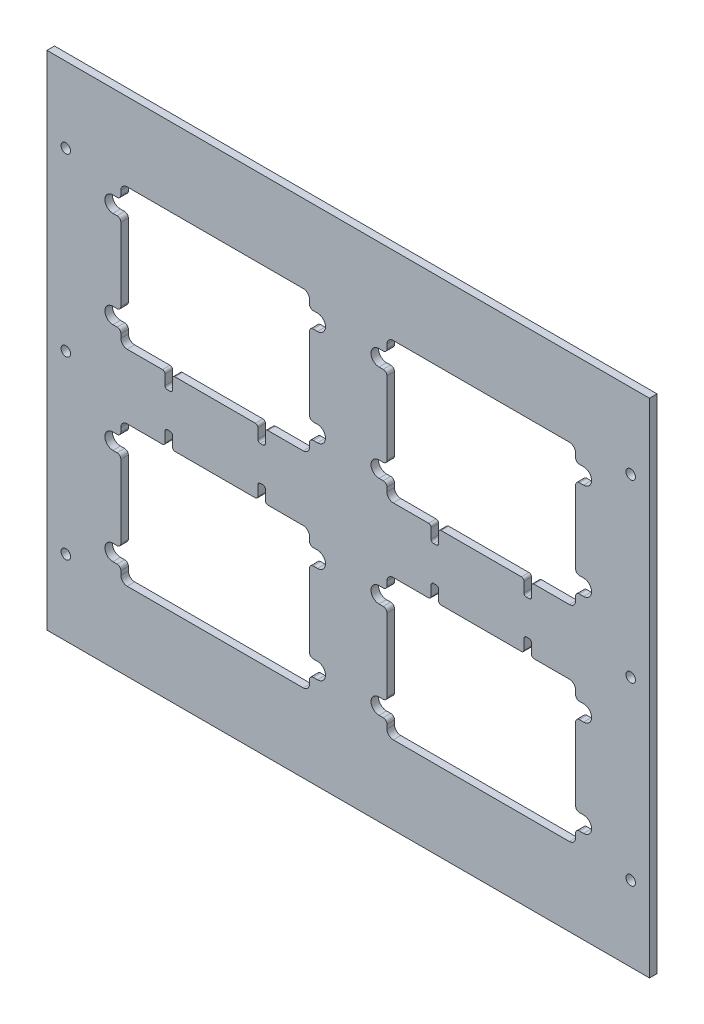
from build123d import *

# Parameters (mm, degrees)
SKETCH2_W                     = 200
SKETCH2_H                     = 240
BOSS_EXTRUDE1_DEPTH           = 3
F_6_CLEARANCE_HOLE1_D         = 3.7973
F_6_CLEARANCE_HOLE1_DEPTH     = 19.9898
F_6_CLEARANCE_HOLE1_TIP       = 1.140824014
BODY_MOVE_COPY1_ANGLE         = 90
TAP_DRILL_FOR_6_32_TAP1_D     = 2.7051
TAP_DRILL_FOR_6_32_TAP1_DEPTH = 20
TAP_DRILL_FOR_6_32_TAP1_TIP   = 0.81269403
CUT_EXTRUDE1_DEPTH            = 395.473066254


with BuildPart() as part:
    # Sketch2 → Boss-Extrude1 (new body)
    with BuildSketch(Plane.XY):
        Rectangle(SKETCH2_W, SKETCH2_H)
    extrude(amount=BOSS_EXTRUDE1_DEPTH)

    # #6 Clearance Hole1
    with Locations(Plane.XY.offset(3)):
        with Locations((-70, 112.5), (0, 112.5), (70, 112.5), (70, -112.5), (0, -112.5), (-70, -112.5)):
            Hole(F_6_CLEARANCE_HOLE1_D / 2, depth=F_6_CLEARANCE_HOLE1_DEPTH)
            with Locations((0, 0, -(F_6_CLEARANCE_HOLE1_DEPTH + F_6_CLEARANCE_HOLE1_TIP / 2))):  # 118° drill point
                Cone(0, F_6_CLEARANCE_HOLE1_D / 2, F_6_CLEARANCE_HOLE1_TIP, mode=Mode.SUBTRACT)


with BuildPart() as part_1:
    # Body-Move/Copy1: read off the stored shape, not the designer's step
    # Body-Move/Copy1: moved
    add(part.part.moved(Location((-100, 220, 0))).rotate(Axis((0, 0, 0), (0, 0, -1)), BODY_MOVE_COPY1_ANGLE))

    # Tap Drill for #6-32 Tap1
    with Locations(Plane(origin=(220, 100, 3), x_dir=(0.0027465713652910567, 0.9999962281657544, 0), z_dir=(0, 0, 1))):
        with Locations((-60.332264473, 93.584646116), (-21.932409311, 93.690114456), (21.41742718, 93.809178325), (59.817282342, 93.914646665), (60.041127908, 12.41495407), (21.641272746, 12.309485729), (-21.708563745, 12.190421861), (-60.108418906, 12.08495352), (-60.041127908, -12.41495407), (-21.641272746, -12.309485729), (21.708563745, -12.190421861), (60.108418906, -12.08495352), (60.332264473, -93.584646116), (21.932409311, -93.690114456), (-21.41742718, -93.809178325), (-59.817282342, -93.914646665)):
            Hole(TAP_DRILL_FOR_6_32_TAP1_D / 2, depth=TAP_DRILL_FOR_6_32_TAP1_DEPTH)
            with Locations((0, 0, -(TAP_DRILL_FOR_6_32_TAP1_DEPTH + TAP_DRILL_FOR_6_32_TAP1_TIP / 2))):  # 118° drill point
                Cone(0, TAP_DRILL_FOR_6_32_TAP1_D / 2, TAP_DRILL_FOR_6_32_TAP1_TIP, mode=Mode.SUBTRACT)

    # Sketch14 → Cut-Extrude1 (cut, through all)
    with BuildSketch(Plane.XY.offset(3)):
        with BuildLine():
            Line((126.25, 163.25), (127.925, 163.25))
            ThreePointArc((127.925, 163.25), (128.985660172, 163.689339828), (129.425, 164.75))
            Line((129.425, 164.75), (129.425, 166.375))
            ThreePointArc((129.425, 166.375), (130.157233047, 168.142766953), (131.925, 168.875))
            Line((131.925, 168.875), (202.075, 168.875))
            ThreePointArc((202.075, 168.875), (203.842766953, 168.142766953), (204.575, 166.375))
            Line((204.575, 166.375), (204.575, 164.75))
            ThreePointArc((204.575, 164.75), (205.014339828, 163.689339828), (206.075, 163.25))
            Line((206.075, 163.25), (207.75, 163.25))
            ThreePointArc((207.75, 163.25), (210.925, 160.075), (207.75, 156.9))
            Line((207.75, 156.9), (206.075, 156.9))
            ThreePointArc((206.075, 156.9), (205.014339828, 156.460660172), (204.575, 155.4))
            Line((204.575, 155.4), (204.575, 126.35))
            ThreePointArc((204.575, 126.35), (205.014339828, 125.289339828), (206.075, 124.85))
            Line((206.075, 124.85), (207.75, 124.85))
            ThreePointArc((207.75, 124.85), (210.925, 121.675), (207.75, 118.5))
            Line((207.75, 118.5), (206.075, 118.5))
            ThreePointArc((206.075, 118.5), (205.014339828, 118.060660172), (204.575, 117))
            Line((204.575, 117), (204.575, 115.375))
            ThreePointArc((204.575, 115.375), (203.842766953, 113.607233047), (202.075, 112.875))
            Line((202.075, 112.875), (188, 112.875))
            ThreePointArc((188, 112.875), (187.292893219, 112.582106781), (187, 111.875))
            Line((187, 111.875), (187, 107.875))
            ThreePointArc((187, 107.875), (186.707106781, 107.167893219), (186, 106.875))
            Line((186, 106.875), (185, 106.875))
            ThreePointArc((185, 106.875), (184.292893219, 107.167893219), (184, 107.875))
            Line((184, 107.875), (184, 111.875))
            ThreePointArc((184, 111.875), (183.707106781, 112.582106781), (183, 112.875))
            Line((183, 112.875), (151, 112.875))
            ThreePointArc((151, 112.875), (150.292893219, 112.582106781), (150, 111.875))
            Line((150, 111.875), (150, 107.875))
            ThreePointArc((150, 107.875), (149.707106781, 107.167893219), (149, 106.875))
            Line((149, 106.875), (148, 106.875))
            ThreePointArc((148, 106.875), (147.292893219, 107.167893219), (147, 107.875))
            Line((147, 107.875), (147, 111.875))
            ThreePointArc((147, 111.875), (146.707106781, 112.582106781), (146, 112.875))
            Line((146, 112.875), (131.925, 112.875))
            ThreePointArc((131.925, 112.875), (130.157233047, 113.607233047), (129.425, 115.375))
            Line((129.425, 115.375), (129.425, 117))
            ThreePointArc((129.425, 117), (128.985660172, 118.060660172), (127.925, 118.5))
            Line((127.925, 118.5), (126.25, 118.5))
            ThreePointArc((126.25, 118.5), (123.075, 121.675), (126.25, 124.85))
            Line((126.25, 124.85), (127.925, 124.85))
            ThreePointArc((127.925, 124.85), (128.985660172, 125.289339828), (129.425, 126.35))
            Line((129.425, 126.35), (129.425, 155.4))
            ThreePointArc((129.425, 155.4), (128.985660172, 156.460660172), (127.925, 156.9))
            Line((127.925, 156.9), (126.25, 156.9))
            ThreePointArc((126.25, 156.9), (123.075, 160.075), (126.25, 163.25))
        make_face()
        with BuildLine():
            Line((292, 106.875), (291, 106.875))
            ThreePointArc((291, 106.875), (290.292893219, 107.167893219), (290, 107.875))
            Line((290, 107.875), (290, 111.875))
            ThreePointArc((290, 111.875), (289.707106781, 112.582106781), (289, 112.875))
            Line((289, 112.875), (257, 112.875))
            ThreePointArc((257, 112.875), (256.292893219, 112.582106781), (256, 111.875))
            Line((256, 111.875), (256, 107.875))
            ThreePointArc((256, 107.875), (255.707106781, 107.167893219), (255, 106.875))
            Line((255, 106.875), (254, 106.875))
            ThreePointArc((254, 106.875), (253.292893219, 107.167893219), (253, 107.875))
            Line((253, 107.875), (253, 111.875))
            ThreePointArc((253, 111.875), (252.707106781, 112.582106781), (252, 112.875))
            Line((252, 112.875), (237.925, 112.875))
            ThreePointArc((237.925, 112.875), (236.157233047, 113.607233047), (235.425, 115.375))
            Line((235.425, 115.375), (235.425, 117))
            ThreePointArc((235.425, 117), (234.985660172, 118.060660172), (233.925, 118.5))
            Line((233.925, 118.5), (232.25, 118.5))
            ThreePointArc((232.25, 118.5), (229.075, 121.675), (232.25, 124.85))
            Line((232.25, 124.85), (233.925, 124.85))
            ThreePointArc((233.925, 124.85), (234.985660172, 125.289339828), (235.425, 126.35))
            Line((235.425, 126.35), (235.425, 155.4))
            ThreePointArc((235.425, 155.4), (234.985660172, 156.460660172), (233.925, 156.9))
            Line((233.925, 156.9), (232.25, 156.9))
            ThreePointArc((232.25, 156.9), (229.075, 160.075), (232.25, 163.25))
            Line((232.25, 163.25), (233.925, 163.25))
            ThreePointArc((233.925, 163.25), (234.985660172, 163.689339828), (235.425, 164.75))
            Line((235.425, 164.75), (235.425, 166.375))
            ThreePointArc((235.425, 166.375), (236.157233047, 168.142766953), (237.925, 168.875))
            Line((237.925, 168.875), (308.075, 168.875))
            ThreePointArc((308.075, 168.875), (309.842766953, 168.142766953), (310.575, 166.375))
            Line((310.575, 166.375), (310.575, 164.75))
            ThreePointArc((310.575, 164.75), (311.014339828, 163.689339828), (312.075, 163.25))
            Line((312.075, 163.25), (313.75, 163.25))
            ThreePointArc((313.75, 163.25), (316.925, 160.075), (313.75, 156.9))
            Line((313.75, 156.9), (312.075, 156.9))
            ThreePointArc((312.075, 156.9), (311.014339828, 156.460660172), (310.575, 155.4))
            Line((310.575, 155.4), (310.575, 126.35))
            ThreePointArc((310.575, 126.35), (311.014339828, 125.289339828), (312.075, 124.85))
            Line((312.075, 124.85), (313.75, 124.85))
            ThreePointArc((313.75, 124.85), (316.925, 121.675), (313.75, 118.5))
            Line((313.75, 118.5), (312.075, 118.5))
            ThreePointArc((312.075, 118.5), (311.014339828, 118.060660172), (310.575, 117))
            Line((310.575, 117), (310.575, 115.375))
            ThreePointArc((310.575, 115.375), (309.842766953, 113.607233047), (308.075, 112.875))
            Line((308.075, 112.875), (294, 112.875))
            ThreePointArc((294, 112.875), (293.292893219, 112.582106781), (293, 111.875))
            Line((293, 111.875), (293, 107.875))
            ThreePointArc((293, 107.875), (292.707106781, 107.167893219), (292, 106.875))
        make_face()
        with BuildLine():
            Line((293, 88.125), (293, 92.125))
            ThreePointArc((293, 92.125), (292.707106781, 92.832106781), (292, 93.125))
            Line((292, 93.125), (291, 93.125))
            ThreePointArc((291, 93.125), (290.292893219, 92.832106781), (290, 92.125))
            Line((290, 92.125), (290, 88.125))
            ThreePointArc((290, 88.125), (289.707106781, 87.417893219), (289, 87.125))
            Line((289, 87.125), (257, 87.125))
            ThreePointArc((257, 87.125), (256.292893219, 87.417893219), (256, 88.125))
            Line((256, 88.125), (256, 92.125))
            ThreePointArc((256, 92.125), (255.707106781, 92.832106781), (255, 93.125))
            Line((255, 93.125), (254, 93.125))
            ThreePointArc((254, 93.125), (253.292893219, 92.832106781), (253, 92.125))
            Line((253, 92.125), (253, 88.125))
            ThreePointArc((253, 88.125), (252.707106781, 87.417893219), (252, 87.125))
            Line((252, 87.125), (237.925, 87.125))
            ThreePointArc((237.925, 87.125), (236.157233047, 86.392766953), (235.425, 84.625))
            Line((235.425, 84.625), (235.425, 83))
            ThreePointArc((235.425, 83), (234.985660172, 81.939339828), (233.925, 81.5))
            Line((233.925, 81.5), (232.25, 81.5))
            ThreePointArc((232.25, 81.5), (229.075, 78.325), (232.25, 75.15))
            Line((232.25, 75.15), (233.925, 75.15))
            ThreePointArc((233.925, 75.15), (234.985660172, 74.710660172), (235.425, 73.65))
            Line((235.425, 73.65), (235.425, 44.6))
            ThreePointArc((235.425, 44.6), (234.985660172, 43.539339828), (233.925, 43.1))
            Line((233.925, 43.1), (232.25, 43.1))
            ThreePointArc((232.25, 43.1), (229.075, 39.925), (232.25, 36.75))
            Line((232.25, 36.75), (233.925, 36.75))
            ThreePointArc((233.925, 36.75), (234.985660172, 36.310660172), (235.425, 35.25))
            Line((235.425, 35.25), (235.425, 33.625))
            ThreePointArc((235.425, 33.625), (236.157233047, 31.857233047), (237.925, 31.125))
            Line((237.925, 31.125), (308.075, 31.125))
            ThreePointArc((308.075, 31.125), (309.842766953, 31.857233047), (310.575, 33.625))
            Line((310.575, 33.625), (310.575, 35.25))
            ThreePointArc((310.575, 35.25), (311.014339828, 36.310660172), (312.075, 36.75))
            Line((312.075, 36.75), (313.75, 36.75))
            ThreePointArc((313.75, 36.75), (316.925, 39.925), (313.75, 43.1))
            Line((313.75, 43.1), (312.075, 43.1))
            ThreePointArc((312.075, 43.1), (311.014339828, 43.539339828), (310.575, 44.6))
            Line((310.575, 44.6), (310.575, 73.65))
            ThreePointArc((310.575, 73.65), (311.014339828, 74.710660172), (312.075, 75.15))
            Line((312.075, 75.15), (313.75, 75.15))
            ThreePointArc((313.75, 75.15), (316.925, 78.325), (313.75, 81.5))
            Line((313.75, 81.5), (312.075, 81.5))
            ThreePointArc((312.075, 81.5), (311.014339828, 81.939339828), (310.575, 83))
            Line((310.575, 83), (310.575, 84.625))
            ThreePointArc((310.575, 84.625), (309.842766953, 86.392766953), (308.075, 87.125))
            Line((308.075, 87.125), (294, 87.125))
            ThreePointArc((294, 87.125), (293.292893219, 87.417893219), (293, 88.125))
        make_face()
        with BuildLine():
            Line((148, 93.125), (149, 93.125))
            ThreePointArc((149, 93.125), (149.707106781, 92.832106781), (150, 92.125))
            Line((150, 92.125), (150, 88.125))
            ThreePointArc((150, 88.125), (150.292893219, 87.417893219), (151, 87.125))
            Line((151, 87.125), (183, 87.125))
            ThreePointArc((183, 87.125), (183.707106781, 87.417893219), (184, 88.125))
            Line((184, 88.125), (184, 92.125))
            ThreePointArc((184, 92.125), (184.292893219, 92.832106781), (185, 93.125))
            Line((185, 93.125), (186, 93.125))
            ThreePointArc((186, 93.125), (186.707106781, 92.832106781), (187, 92.125))
            Line((187, 92.125), (187, 88.125))
            ThreePointArc((187, 88.125), (187.292893219, 87.417893219), (188, 87.125))
            Line((188, 87.125), (202.075, 87.125))
            ThreePointArc((202.075, 87.125), (203.842766953, 86.392766953), (204.575, 84.625))
            Line((204.575, 84.625), (204.575, 83))
            ThreePointArc((204.575, 83), (205.014339828, 81.939339828), (206.075, 81.5))
            Line((206.075, 81.5), (207.75, 81.5))
            ThreePointArc((207.75, 81.5), (210.925, 78.325), (207.75, 75.15))
            Line((207.75, 75.15), (206.075, 75.15))
            ThreePointArc((206.075, 75.15), (205.014339828, 74.710660172), (204.575, 73.65))
            Line((204.575, 73.65), (204.575, 44.6))
            ThreePointArc((204.575, 44.6), (205.014339828, 43.539339828), (206.075, 43.1))
            Line((206.075, 43.1), (207.75, 43.1))
            ThreePointArc((207.75, 43.1), (210.925, 39.925), (207.75, 36.75))
            Line((207.75, 36.75), (206.075, 36.75))
            ThreePointArc((206.075, 36.75), (205.014339828, 36.310660172), (204.575, 35.25))
            Line((204.575, 35.25), (204.575, 33.625))
            ThreePointArc((204.575, 33.625), (203.842766953, 31.857233047), (202.075, 31.125))
            Line((202.075, 31.125), (131.925, 31.125))
            ThreePointArc((131.925, 31.125), (130.157233047, 31.857233047), (129.425, 33.625))
            Line((129.425, 33.625), (129.425, 35.25))
            ThreePointArc((129.425, 35.25), (128.985660172, 36.310660172), (127.925, 36.75))
            Line((127.925, 36.75), (126.25, 36.75))
            ThreePointArc((126.25, 36.75), (123.075, 39.925), (126.25, 43.1))
            Line((126.25, 43.1), (127.925, 43.1))
            ThreePointArc((127.925, 43.1), (128.985660172, 43.539339828), (129.425, 44.6))
            Line((129.425, 44.6), (129.425, 73.65))
            ThreePointArc((129.425, 73.65), (128.985660172, 74.710660172), (127.925, 75.15))
            Line((127.925, 75.15), (126.25, 75.15))
            ThreePointArc((126.25, 75.15), (123.075, 78.325), (126.25, 81.5))
            Line((126.25, 81.5), (127.925, 81.5))
            ThreePointArc((127.925, 81.5), (128.985660172, 81.939339828), (129.425, 83))
            Line((129.425, 83), (129.425, 84.625))
            ThreePointArc((129.425, 84.625), (130.157233047, 86.392766953), (131.925, 87.125))
            Line((131.925, 87.125), (146, 87.125))
            ThreePointArc((146, 87.125), (146.707106781, 87.417893219), (147, 88.125))
            Line((147, 88.125), (147, 92.125))
            ThreePointArc((147, 92.125), (147.292893219, 92.832106781), (148, 93.125))
        make_face()
    extrude(amount=-CUT_EXTRUDE1_DEPTH, mode=Mode.SUBTRACT)


solid = part_1.part
